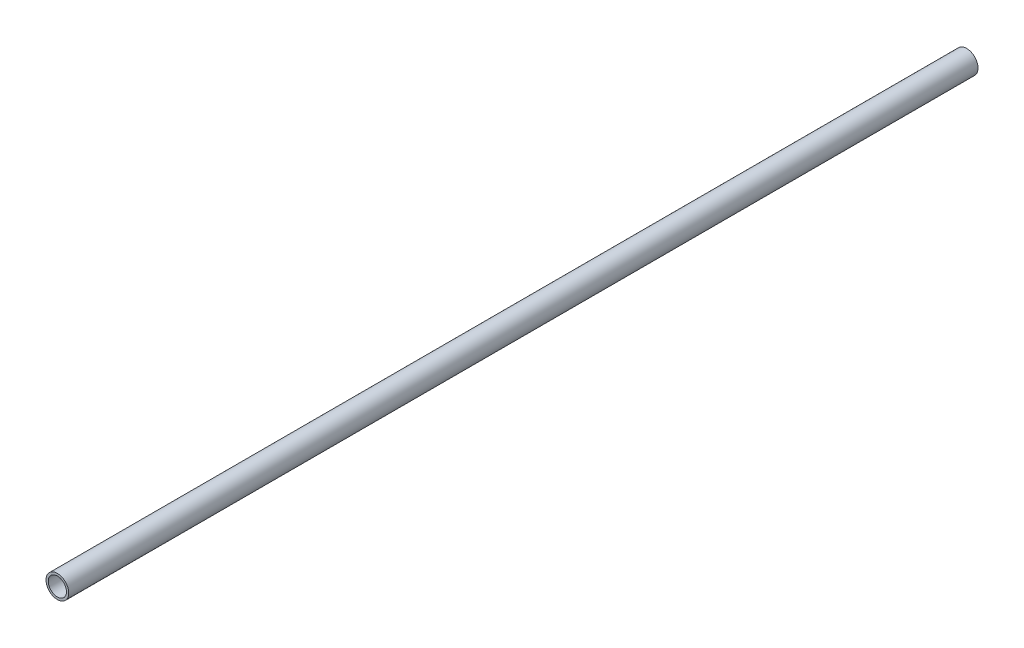
from build123d import *

# Parameters (mm, degrees)
SKETCH1_R           = 5
SKETCH1_R_2         = 4
BOSS_EXTRUDE1_DEPTH = 200.025


with BuildPart() as part:
    # Sketch1 → Boss-Extrude1 (new, symmetric)
    with BuildSketch(Plane.XY):
        Circle(SKETCH1_R)
        Circle(SKETCH1_R_2, mode=Mode.SUBTRACT)
    extrude(amount=BOSS_EXTRUDE1_DEPTH, both=True)


solid = part.part
